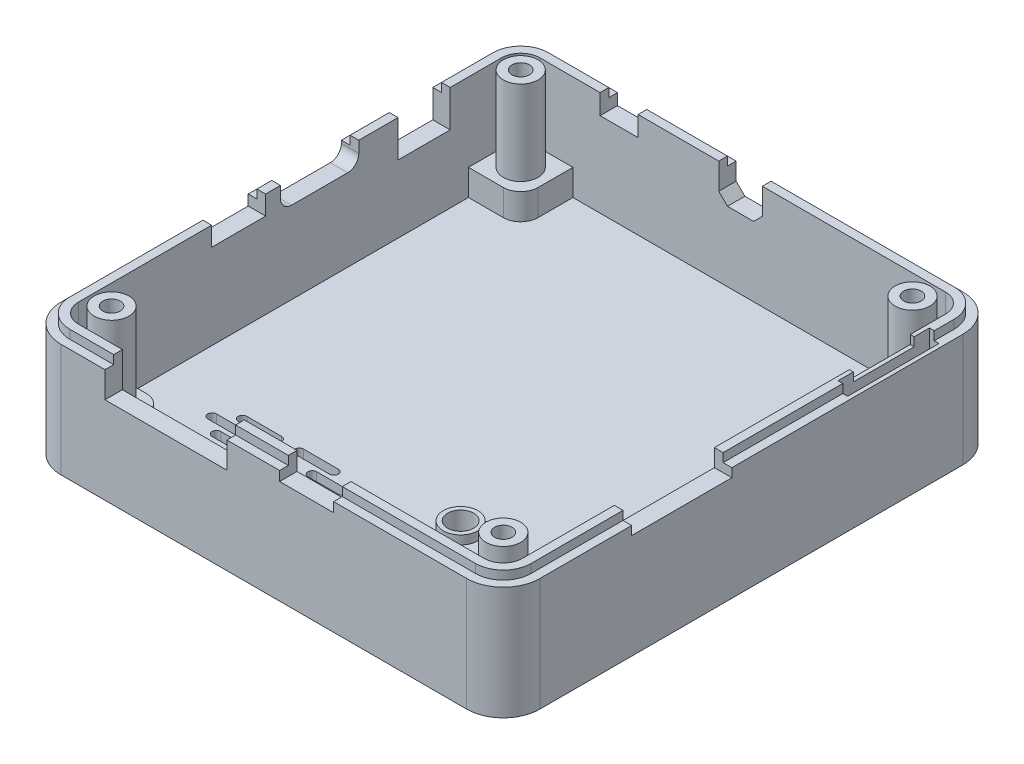
from build123d import *

# Parameters (mm, degrees)
BOSS_EXTRUDE1_DEPTH   = 13
BOSS_EXTRUDE2_DEPTH   = 14
BOSS_EXTRUDE3_DEPTH   = 2
SKETCH1_5_R           = 1
BOSS_EXTRUDE4_DEPTH   = 5
SKETCH2_R             = 2
SKETCH2_R_2           = 1
BOSS_EXTRUDE5_DEPTH   = 9.7
SKETCH3_W             = 6
SKETCH3_H             = 4.22
SKETCH3_W_2           = 6.2
SKETCH3_H_2           = 2.2
CUT_EXTRUDE1_DEPTH    = 2
SKETCH5_W             = 4.36
SKETCH5_H             = 2.3
CUT_EXTRUDE3_DEPTH    = 2
SKETCH6_W             = 1.1
SKETCH6_H             = 10.5
CUT_EXTRUDE4_DEPTH    = 3
SKETCH7_W             = 7
SKETCH7_H             = 1
SKETCH7_W_2           = 11.5
SKETCH7_H_2           = 2
CUT_EXTRUDE5_DEPTH    = 2
SKETCH8_R             = 1
BOSS_EXTRUDE6_DEPTH   = 2
BOSS_EXTRUDE6_2_DEPTH = 2
BOSS_EXTRUDE6_3_DEPTH = 2
BOSS_EXTRUDE6_4_DEPTH = 2
SKETCH9_W             = 14
SKETCH9_H             = 4
SKETCH9_W_2           = 6.2
SKETCH9_H_2           = 2.1
CUT_EXTRUDE6_DEPTH    = 2
SKETCH10_R            = 1.5
CUT_EXTRUDE7_DEPTH    = 2
CUT_EXTRUDE8_DEPTH    = 2
SKETCH12_R            = 2
SKETCH12_R_2          = 1.5
BOSS_EXTRUDE7_DEPTH   = 1


with BuildPart() as part:
    # Sketch1 → Boss-Extrude1 (new body)
    with BuildSketch(Plane(origin=(0, 0, 0), x_dir=(1, 0, 0), z_dir=(0, 1, 0))):
        with BuildLine():
            Line((23.3, 28.5), (-23.3, 28.5))
            ThreePointArc((-23.3, 28.5), (-26.269848481, 27.269848481), (-27.5, 24.3))
            Line((-27.5, 24.3), (-27.5, -24.3))
            ThreePointArc((-27.5, -24.3), (-26.269848481, -27.269848481), (-23.3, -28.5))
            Line((-23.3, -28.5), (23.3, -28.5))
            ThreePointArc((23.3, -28.5), (26.269848481, -27.269848481), (27.5, -24.3))
            Line((27.5, -24.3), (27.5, 24.3))
            ThreePointArc((27.5, 24.3), (26.269848481, 27.269848481), (23.3, 28.5))
        make_face()
        with BuildLine():
            ThreePointArc((-26.5, 24.3), (-25.5627417, 26.5627417), (-23.3, 27.5))
            Line((-23.3, 27.5), (23.3, 27.5))
            ThreePointArc((23.3, 27.5), (25.5627417, 26.5627417), (26.5, 24.3))
            Line((26.5, 24.3), (26.5, -24.3))
            ThreePointArc((26.5, -24.3), (25.5627417, -26.5627417), (23.3, -27.5))
            Line((23.3, -27.5), (-23.3, -27.5))
            ThreePointArc((-23.3, -27.5), (-25.5627417, -26.5627417), (-26.5, -24.3))
            Line((-26.5, -24.3), (-26.5, 24.3))
        make_face(mode=Mode.SUBTRACT)
    extrude(amount=BOSS_EXTRUDE1_DEPTH)

    # Sketch1<3> → Boss-Extrude2 (add)
    with BuildSketch(Plane(origin=(0, 0, 0), x_dir=(1, 0, 0), z_dir=(0, 1, 0))):
        with BuildLine():
            Line((23.3, 27.5), (-23.3, 27.5))
            ThreePointArc((-23.3, 27.5), (-25.5627417, 26.5627417), (-26.5, 24.3))
            Line((-26.5, 24.3), (-26.5, -24.3))
            ThreePointArc((-26.5, -24.3), (-25.5627417, -26.5627417), (-23.3, -27.5))
            Line((-23.3, -27.5), (23.3, -27.5))
            ThreePointArc((23.3, -27.5), (25.5627417, -26.5627417), (26.5, -24.3))
            Line((26.5, -24.3), (26.5, 24.3))
            ThreePointArc((26.5, 24.3), (25.5627417, 26.5627417), (23.3, 27.5))
        make_face()
        with BuildLine():
            ThreePointArc((-25.5, 24.3), (-24.855634919, 25.855634919), (-23.3, 26.5))
            Line((-23.3, 26.5), (-19.5, 26.5))
            Line((-19.5, 26.5), (19.5, 26.5))
            Line((19.5, 26.5), (23.3, 26.5))
            ThreePointArc((23.3, 26.5), (24.855634919, 25.855634919), (25.5, 24.3))
            Line((25.5, 24.3), (25.5, 20.5))
            Line((25.5, 20.5), (25.5, -20.5))
            Line((25.5, -20.5), (25.5, -24.3))
            ThreePointArc((25.5, -24.3), (24.855634919, -25.855634919), (23.3, -26.5))
            Line((23.3, -26.5), (19.5, -26.5))
            Line((19.5, -26.5), (-19.5, -26.5))
            Line((-19.5, -26.5), (-23.3, -26.5))
            ThreePointArc((-23.3, -26.5), (-24.855634919, -25.855634919), (-25.5, -24.3))
            Line((-25.5, -24.3), (-25.5, -20.5))
            Line((-25.5, -20.5), (-25.5, 20.5))
            Line((-25.5, 20.5), (-25.5, 24.3))
        make_face(mode=Mode.SUBTRACT)
    extrude(amount=BOSS_EXTRUDE2_DEPTH)

    # Sketch1<4> → Boss-Extrude3 (add)
    with BuildSketch(Plane(origin=(0, 0, 0), x_dir=(1, 0, 0), z_dir=(0, 1, 0))):
        with BuildLine():
            Line((19.5, 26.5), (-19.5, 26.5))
            Line((-19.5, 26.5), (-19.5, 22.5))
            ThreePointArc((-19.5, 22.5), (-20.085786438, 21.085786438), (-21.5, 20.5))
            Line((-21.5, 20.5), (-25.5, 20.5))
            Line((-25.5, 20.5), (-25.5, -20.5))
            Line((-25.5, -20.5), (-21.5, -20.5))
            ThreePointArc((-21.5, -20.5), (-20.085786438, -21.085786438), (-19.5, -22.5))
            Line((-19.5, -22.5), (-19.5, -26.5))
            Line((-19.5, -26.5), (19.5, -26.5))
            Line((19.5, -26.5), (19.5, -22.5))
            ThreePointArc((19.5, -22.5), (20.085786438, -21.085786438), (21.5, -20.5))
            Line((21.5, -20.5), (25.5, -20.5))
            Line((25.5, -20.5), (25.5, 20.5))
            Line((25.5, 20.5), (21.5, 20.5))
            ThreePointArc((21.5, 20.5), (20.085786438, 21.085786438), (19.5, 22.5))
            Line((19.5, 22.5), (19.5, 26.5))
        make_face()
    extrude(amount=BOSS_EXTRUDE3_DEPTH)

    # Sketch1<5> → Boss-Extrude4 (add)
    # profile 1 of 4: a face of its own
    with BuildSketch(Plane(origin=(0, 0, 0), x_dir=(1, 0, 0), z_dir=(0, 1, 0))):
        with BuildLine():
            Line((-19.5, 26.5), (-23.3, 26.5))
            ThreePointArc((-23.3, 26.5), (-24.855634919, 25.855634919), (-25.5, 24.3))
            Line((-25.5, 24.3), (-25.5, 20.5))
            Line((-25.5, 20.5), (-21.5, 20.5))
            ThreePointArc((-21.5, 20.5), (-20.085786438, 21.085786438), (-19.5, 22.5))
            Line((-19.5, 22.5), (-19.5, 26.5))
        make_face()
        with Locations((-22.5, 23.5)):
            Circle(SKETCH1_5_R, mode=Mode.SUBTRACT)
    # profile 2 of 4: a face of its own
    with BuildSketch(Plane(origin=(0, 0, 0), x_dir=(1, 0, 0), z_dir=(0, 1, 0))):
        with BuildLine():
            Line((23.3, 26.5), (19.5, 26.5))
            Line((19.5, 26.5), (19.5, 22.5))
            ThreePointArc((19.5, 22.5), (20.085786438, 21.085786438), (21.5, 20.5))
            Line((21.5, 20.5), (25.5, 20.5))
            Line((25.5, 20.5), (25.5, 24.3))
            ThreePointArc((25.5, 24.3), (24.855634919, 25.855634919), (23.3, 26.5))
        make_face()
        with Locations((22.5, 23.5)):
            Circle(SKETCH1_5_R, mode=Mode.SUBTRACT)
    # profile 3 of 4: a face of its own
    with BuildSketch(Plane(origin=(0, 0, 0), x_dir=(1, 0, 0), z_dir=(0, 1, 0))):
        with BuildLine():
            Line((-21.5, -20.5), (-25.5, -20.5))
            Line((-25.5, -20.5), (-25.5, -24.3))
            ThreePointArc((-25.5, -24.3), (-24.855634919, -25.855634919), (-23.3, -26.5))
            Line((-23.3, -26.5), (-19.5, -26.5))
            Line((-19.5, -26.5), (-19.5, -22.5))
            ThreePointArc((-19.5, -22.5), (-20.085786438, -21.085786438), (-21.5, -20.5))
        make_face()
        with Locations((-22.5, -23.5)):
            Circle(SKETCH1_5_R, mode=Mode.SUBTRACT)
    # profile 4 of 4: a face of its own
    with BuildSketch(Plane(origin=(0, 0, 0), x_dir=(1, 0, 0), z_dir=(0, 1, 0))):
        with BuildLine():
            Line((25.5, -24.3), (25.5, -20.5))
            Line((25.5, -20.5), (21.5, -20.5))
            ThreePointArc((21.5, -20.5), (20.085786438, -21.085786438), (19.5, -22.5))
            Line((19.5, -22.5), (19.5, -26.5))
            Line((19.5, -26.5), (23.3, -26.5))
            ThreePointArc((23.3, -26.5), (24.855634919, -25.855634919), (25.5, -24.3))
        make_face()
        with Locations((22.5, -23.5)):
            Circle(SKETCH1_5_R, mode=Mode.SUBTRACT)
    extrude(amount=BOSS_EXTRUDE4_DEPTH)

    # Sketch2 → Boss-Extrude5 (add)
    # profile 1 of 4: a face of its own
    with BuildSketch(Plane(origin=(0, 5, 0), x_dir=(1, 0, 0), z_dir=(0, 1, 0))):
        with Locations((-22.5, -23.5)):
            Circle(SKETCH2_R)
        with Locations((-22.5, -23.5)):
            Circle(SKETCH2_R_2, mode=Mode.SUBTRACT)
    # profile 2 of 4: a face of its own
    with BuildSketch(Plane(origin=(0, 5, 0), x_dir=(1, 0, 0), z_dir=(0, 1, 0))):
        with Locations((22.5, -23.5)):
            Circle(SKETCH2_R)
        with Locations((22.5, -23.5)):
            Circle(SKETCH2_R_2, mode=Mode.SUBTRACT)
    # profile 3 of 4: a face of its own
    with BuildSketch(Plane(origin=(0, 5, 0), x_dir=(1, 0, 0), z_dir=(0, 1, 0))):
        with Locations((22.5, 23.5)):
            Circle(SKETCH2_R)
        with Locations((22.5, 23.5)):
            Circle(SKETCH2_R_2, mode=Mode.SUBTRACT)
    # profile 4 of 4: a face of its own
    with BuildSketch(Plane(origin=(0, 5, 0), x_dir=(1, 0, 0), z_dir=(0, 1, 0))):
        with Locations((-22.5, 23.5)):
            Circle(SKETCH2_R)
        with Locations((-22.5, 23.5)):
            Circle(SKETCH2_R_2, mode=Mode.SUBTRACT)
    extrude(amount=BOSS_EXTRUDE5_DEPTH)

    # Sketch3 → Cut-Extrude1 (cut)
    with BuildSketch(Plane.ZY.offset(27.5)):
        with Locations((-15.4, 11.89)):
            Rectangle(SKETCH3_W, SKETCH3_H)
        with BuildLine():
            Line((-7.9, 14), (1.1, 14))
            Line((1.1, 14), (1.1, 12.68))
            ThreePointArc((1.1, 12.68), (0.72509668, 11.77490332), (-0.18, 11.4))
            Line((-0.18, 11.4), (-6.62, 11.4))
            ThreePointArc((-6.62, 11.4), (-7.52509668, 11.77490332), (-7.9, 12.68))
            Line((-7.9, 12.68), (-7.9, 14))
        make_face()
        with Locations((5.9, 12.9)):
            Rectangle(SKETCH3_W_2, SKETCH3_H_2)
    extrude(amount=-CUT_EXTRUDE1_DEPTH, mode=Mode.SUBTRACT)

    # Sketch5 → Cut-Extrude3 (cut)
    with BuildSketch(Plane(origin=(0, 0, -28.5), x_dir=(-1, 0, 0), z_dir=(0, 0, -1))):
        Polygon((1.75, 10), (-1.25, 10), (-2.25, 11), (-2.25, 14), (2.75, 14), (2.75, 11), align=None)
        with Locations((14.2, 12.85)):
            Rectangle(SKETCH5_W, SKETCH5_H)
    extrude(amount=-CUT_EXTRUDE3_DEPTH, mode=Mode.SUBTRACT)

    # Sketch6 → Cut-Extrude4 (cut)
    with BuildSketch(Plane(origin=(0, 14, 0), x_dir=(1, 0, 0), z_dir=(0, 1, 0))):
        with Locations((26.5, 16.75)):
            Rectangle(SKETCH6_W, SKETCH6_H)
    extrude(amount=-CUT_EXTRUDE4_DEPTH, mode=Mode.SUBTRACT)

    # Sketch7 → Cut-Extrude5 (cut)
    with BuildSketch(Plane(origin=(27.5, 0, 0), x_dir=(0, 0, -1), z_dir=(1, 0, 0))):
        with Locations((16.75, 13.5)):
            Rectangle(SKETCH7_W, SKETCH7_H)
        with Locations((-8, 13)):
            Rectangle(SKETCH7_W_2, SKETCH7_H_2)
    extrude(amount=-CUT_EXTRUDE5_DEPTH, mode=Mode.SUBTRACT)

    # Sketch9 → Cut-Extrude6 (cut)
    with BuildSketch(Plane.XY.offset(28.5)):
        with Locations((-11.25, 12)):
            Rectangle(SKETCH9_W, SKETCH9_H)
        with Locations((4.91, 12.95)):
            Rectangle(SKETCH9_W_2, SKETCH9_H_2)
    extrude(amount=-CUT_EXTRUDE6_DEPTH, mode=Mode.SUBTRACT)

    # Sketch10 → Cut-Extrude7 (cut)
    with BuildSketch(Plane.XZ):
        with Locations((7.2, 17.6)):
            Circle(SKETCH10_R)
        with Locations((7.2, 13.1)):
            Circle(SKETCH10_R)
    extrude(amount=-CUT_EXTRUDE7_DEPTH, mode=Mode.SUBTRACT)

    # Sketch11 → Cut-Extrude8 (cut)
    with BuildSketch(Plane.XZ):
        with BuildLine():
            Line((-12.95, 19.5), (-9.45, 19.5))
            ThreePointArc((-9.45, 19.5), (-8.95, 19), (-9.45, 18.5))
            Line((-9.45, 18.5), (-12.95, 18.5))
            ThreePointArc((-12.95, 18.5), (-13.45, 19), (-12.95, 19.5))
        make_face()
        with BuildLine():
            Line((-6.95, 19.5), (-3.45, 19.5))
            ThreePointArc((-3.45, 19.5), (-2.95, 19), (-3.45, 18.5))
            Line((-3.45, 18.5), (-6.95, 18.5))
            ThreePointArc((-6.95, 18.5), (-7.45, 19), (-6.95, 19.5))
        make_face()
        with BuildLine():
            Line((-18.45, 19.5), (-14.95, 19.5))
            ThreePointArc((-14.95, 19.5), (-14.45, 19), (-14.95, 18.5))
            Line((-14.95, 18.5), (-18.45, 18.5))
            ThreePointArc((-18.45, 18.5), (-18.95, 19), (-18.45, 19.5))
        make_face()
        with BuildLine():
            Line((-16.453190507, 21), (-12.453190507, 21))
            ThreePointArc((-12.453190507, 21), (-11.953190507, 20.5), (-12.453190507, 20))
            Line((-12.453190507, 20), (-16.453190507, 20))
            ThreePointArc((-16.453190507, 20), (-16.953190507, 20.5), (-16.453190507, 21))
        make_face()
        with BuildLine():
            Line((-9.953190507, 21), (-5.953190507, 21))
            ThreePointArc((-5.953190507, 21), (-5.453190507, 20.5), (-5.953190507, 20))
            Line((-5.953190507, 20), (-9.953190507, 20))
            ThreePointArc((-9.953190507, 20), (-10.453190507, 20.5), (-9.953190507, 21))
        make_face()
        with BuildLine():
            Line((-9.953190507, 18), (-5.953190507, 18))
            ThreePointArc((-5.953190507, 18), (-5.453190507, 17.5), (-5.953190507, 17))
            Line((-5.953190507, 17), (-9.953190507, 17))
            ThreePointArc((-9.953190507, 17), (-10.453190507, 17.5), (-9.953190507, 18))
        make_face()
        with BuildLine():
            Line((-16.453190507, 18), (-12.453190507, 18))
            ThreePointArc((-12.453190507, 18), (-11.953190507, 17.5), (-12.453190507, 17))
            Line((-12.453190507, 17), (-16.453190507, 17))
            ThreePointArc((-16.453190507, 17), (-16.953190507, 17.5), (-16.453190507, 18))
        make_face()
        with BuildLine():
            Line((-18.45, 22.5), (-14.95, 22.5))
            ThreePointArc((-14.95, 22.5), (-14.45, 22), (-14.95, 21.5))
            Line((-14.95, 21.5), (-18.45, 21.5))
            ThreePointArc((-18.45, 21.5), (-18.95, 22), (-18.45, 22.5))
        make_face()
        with BuildLine():
            Line((-6.95, 22.5), (-3.45, 22.5))
            ThreePointArc((-3.45, 22.5), (-2.95, 22), (-3.45, 21.5))
            Line((-3.45, 21.5), (-6.95, 21.5))
            ThreePointArc((-6.95, 21.5), (-7.45, 22), (-6.95, 22.5))
        make_face()
        with BuildLine():
            Line((-12.95, 22.5), (-9.45, 22.5))
            ThreePointArc((-9.45, 22.5), (-8.95, 22), (-9.45, 21.5))
            Line((-9.45, 21.5), (-12.95, 21.5))
            ThreePointArc((-12.95, 21.5), (-13.45, 22), (-12.95, 22.5))
        make_face()
        with BuildLine():
            Line((-18.45, 16.5), (-14.95, 16.5))
            ThreePointArc((-14.95, 16.5), (-14.45, 16), (-14.95, 15.5))
            Line((-14.95, 15.5), (-18.45, 15.5))
            ThreePointArc((-18.45, 15.5), (-18.95, 16), (-18.45, 16.5))
        make_face()
        with BuildLine():
            Line((-6.95, 16.5), (-3.45, 16.5))
            ThreePointArc((-3.45, 16.5), (-2.95, 16), (-3.45, 15.5))
            Line((-3.45, 15.5), (-6.95, 15.5))
            ThreePointArc((-6.95, 15.5), (-7.45, 16), (-6.95, 16.5))
        make_face()
        with BuildLine():
            Line((-12.95, 16.5), (-9.45, 16.5))
            ThreePointArc((-9.45, 16.5), (-8.95, 16), (-9.45, 15.5))
            Line((-9.45, 15.5), (-12.95, 15.5))
            ThreePointArc((-12.95, 15.5), (-13.45, 16), (-12.95, 16.5))
        make_face()
        with BuildLine():
            Line((-9.953190507, 24), (-5.953190507, 24))
            ThreePointArc((-5.953190507, 24), (-5.453190507, 23.5), (-5.953190507, 23))
            Line((-5.953190507, 23), (-9.953190507, 23))
            ThreePointArc((-9.953190507, 23), (-10.453190507, 23.5), (-9.953190507, 24))
        make_face()
        with BuildLine():
            Line((-16.453190507, 24), (-12.453190507, 24))
            ThreePointArc((-12.453190507, 24), (-11.953190507, 23.5), (-12.453190507, 23))
            Line((-12.453190507, 23), (-16.453190507, 23))
            ThreePointArc((-16.453190507, 23), (-16.953190507, 23.5), (-16.453190507, 24))
        make_face()
        with BuildLine():
            Line((-16.453190507, 15), (-12.453190507, 15))
            ThreePointArc((-12.453190507, 15), (-11.953190507, 14.5), (-12.453190507, 14))
            Line((-12.453190507, 14), (-16.453190507, 14))
            ThreePointArc((-16.453190507, 14), (-16.953190507, 14.5), (-16.453190507, 15))
        make_face()
        with BuildLine():
            Line((-9.953190507, 15), (-5.953190507, 15))
            ThreePointArc((-5.953190507, 15), (-5.453190507, 14.5), (-5.953190507, 14))
            Line((-5.953190507, 14), (-9.953190507, 14))
            ThreePointArc((-9.953190507, 14), (-10.453190507, 14.5), (-9.953190507, 15))
        make_face()
        with BuildLine():
            Line((-12.95, 25.5), (-9.45, 25.5))
            ThreePointArc((-9.45, 25.5), (-8.95, 25), (-9.45, 24.5))
            Line((-9.45, 24.5), (-12.95, 24.5))
            ThreePointArc((-12.95, 24.5), (-13.45, 25), (-12.95, 25.5))
        make_face()
        with BuildLine():
            Line((-6.95, 25.5), (-3.45, 25.5))
            ThreePointArc((-3.45, 25.5), (-2.95, 25), (-3.45, 24.5))
            Line((-3.45, 24.5), (-6.95, 24.5))
            ThreePointArc((-6.95, 24.5), (-7.45, 25), (-6.95, 25.5))
        make_face()
        with BuildLine():
            Line((-18.45, 25.5), (-14.95, 25.5))
            ThreePointArc((-14.95, 25.5), (-14.45, 25), (-14.95, 24.5))
            Line((-14.95, 24.5), (-18.45, 24.5))
            ThreePointArc((-18.45, 24.5), (-18.95, 25), (-18.45, 25.5))
        make_face()
    extrude(amount=-CUT_EXTRUDE8_DEPTH, mode=Mode.SUBTRACT)

    # Sketch12 → Boss-Extrude7 (add)
    # profile 1 of 2: a face of its own
    with BuildSketch(Plane(origin=(0, 2, 0), x_dir=(1, 0, 0), z_dir=(0, 1, 0))):
        with Locations((7.2, -13.1)):
            Circle(SKETCH12_R)
        with Locations((7.2, -13.1)):
            Circle(SKETCH12_R_2, mode=Mode.SUBTRACT)
    # profile 2 of 2: a face of its own
    with BuildSketch(Plane(origin=(0, 2, 0), x_dir=(1, 0, 0), z_dir=(0, 1, 0))):
        with Locations((7.2, -17.6)):
            Circle(SKETCH12_R)
        with Locations((7.2, -17.6)):
            Circle(SKETCH12_R_2, mode=Mode.SUBTRACT)
    extrude(amount=BOSS_EXTRUDE7_DEPTH)


with BuildPart() as body_2:
    # Sketch8 → Boss-Extrude6 (new body)
    with BuildSketch(Plane.XZ):
        with Locations((-22.5, 23.5)):
            Circle(SKETCH8_R)
    extrude(amount=-BOSS_EXTRUDE6_DEPTH)


with BuildPart() as body_3:
    # Sketch8 → Boss-Extrude6 2 (new body)
    with BuildSketch(Plane.XZ):
        with Locations((22.5, 23.5)):
            Circle(SKETCH8_R)
    extrude(amount=-BOSS_EXTRUDE6_2_DEPTH)


with BuildPart() as body_4:
    # Sketch8 → Boss-Extrude6 3 (new body)
    with BuildSketch(Plane.XZ):
        with Locations((-22.5, -23.5)):
            Circle(SKETCH8_R)
    extrude(amount=-BOSS_EXTRUDE6_3_DEPTH)


with BuildPart() as body_5:
    # Sketch8 → Boss-Extrude6 4 (new body)
    with BuildSketch(Plane.XZ):
        with Locations((22.5, -23.5)):
            Circle(SKETCH8_R)
    extrude(amount=-BOSS_EXTRUDE6_4_DEPTH)


solid = Compound([part.part, body_2.part, body_3.part, body_4.part, body_5.part])
